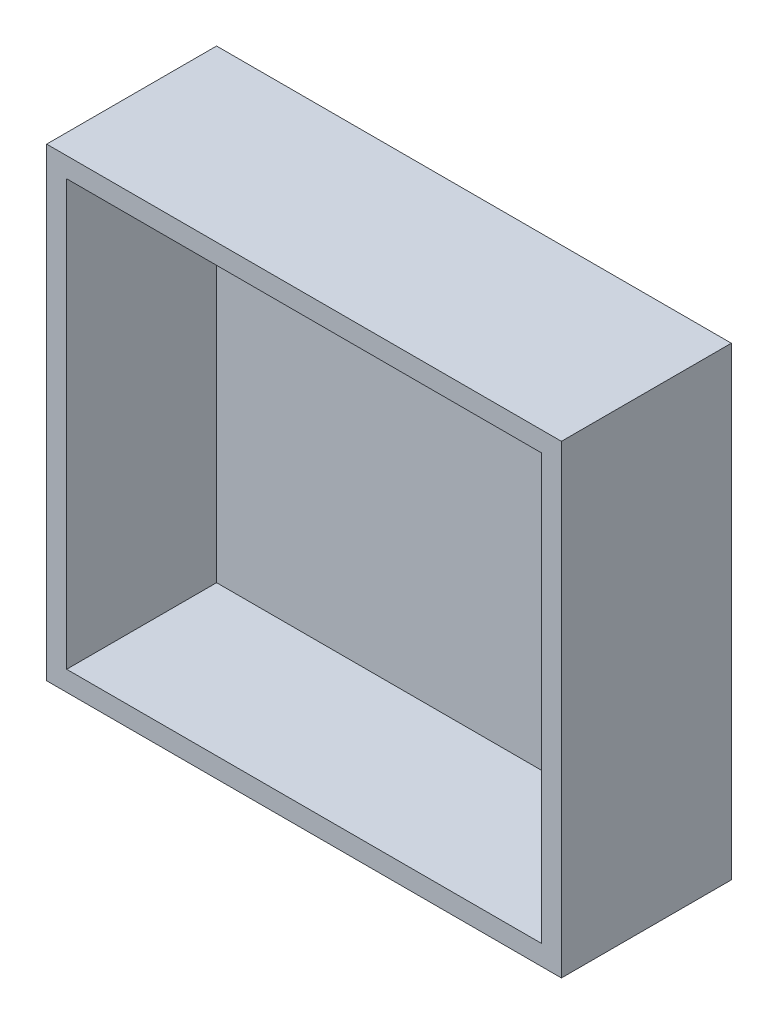
from build123d import *

# Parameters (mm, degrees)
ESQUISSE1_W        = 206
ESQUISSE1_H        = 186
ESQUISSE1_W_2      = 190
ESQUISSE1_H_2      = 170
BOSS_EXTRU_3_DEPTH = 60
ESQUISSE1_2_W      = 206
ESQUISSE1_2_H      = 186
BOSS_EXTRU_4_DEPTH = 8


with BuildPart() as part:
    # Esquisse1 → Boss.-Extru.3 (new body)
    with BuildSketch(Plane.XY):
        with Locations((95, 85)):
            Rectangle(ESQUISSE1_W, ESQUISSE1_H)
        with Locations((95, 85)):
            Rectangle(ESQUISSE1_W_2, ESQUISSE1_H_2, mode=Mode.SUBTRACT)
    extrude(amount=BOSS_EXTRU_3_DEPTH)

    # Esquisse1<2> → Boss.-Extru.4 (add)
    with BuildSketch(Plane.XY):
        with Locations((95, 85)):
            Rectangle(ESQUISSE1_2_W, ESQUISSE1_2_H)
    extrude(amount=-BOSS_EXTRU_4_DEPTH)


solid = part.part
